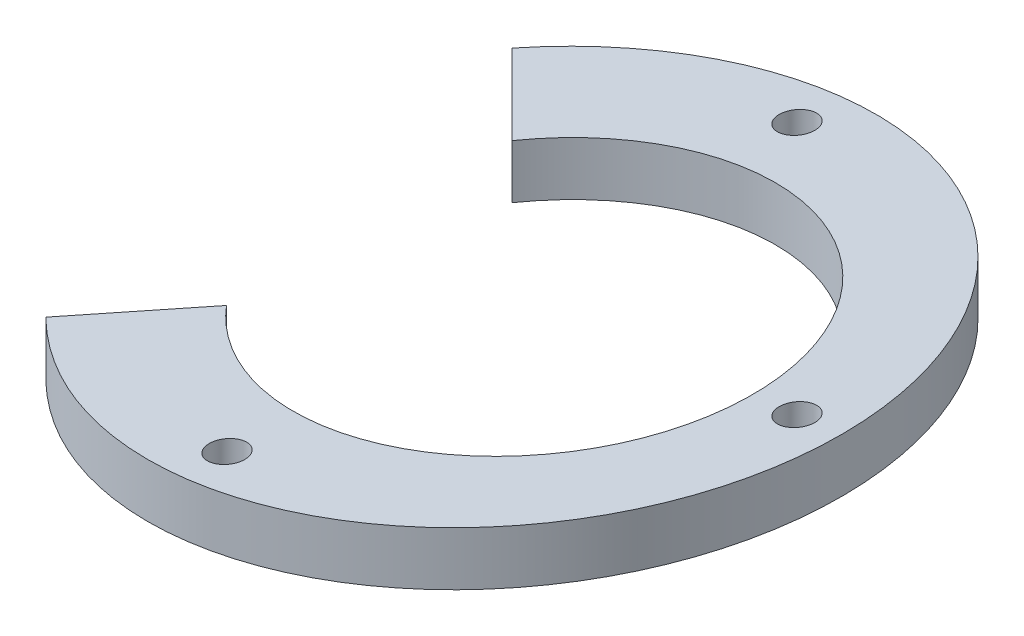
from build123d import *

# Parameters (mm, degrees)
SKETCH1_R           = 37
SKETCH1_R_2         = 2
SKETCH1_R_3         = 24.5
BOSS_EXTRUDE1_DEPTH = 50
CUT_EXTRUDE1_DEPTH  = 500
CUT_EXTRUDE2_REACH  = 56.255
SKETCH4_R           = 3.5
CUT_EXTRUDE3_DEPTH  = 10


with BuildPart() as part:
    # Sketch1 → Boss-Extrude1 (new body)
    with BuildSketch(Plane(origin=(0, 0, 0), x_dir=(1, 0, 0), z_dir=(0, 1, 0))):
        Circle(SKETCH1_R)
        with Locations((0, -32)):
            Circle(SKETCH1_R_2, mode=Mode.SUBTRACT)
        with Locations((32, 0)):
            Circle(SKETCH1_R_2, mode=Mode.SUBTRACT)
        with Locations((-32, 0)):
            Circle(SKETCH1_R_2, mode=Mode.SUBTRACT)
        with Locations((0, 32)):
            Circle(SKETCH1_R_2, mode=Mode.SUBTRACT)
        with Locations((2.5, 0)):
            Circle(SKETCH1_R_3, mode=Mode.SUBTRACT)
    extrude(amount=BOSS_EXTRUDE1_DEPTH)

    # Sketch2 → Cut-Extrude1 (cut, symmetric)
    with BuildSketch(Plane.XY):
        Polygon((37, 8.300429934), (-37, 0), (37, 0), align=None)
        Polygon((-37, 50), (-37, 6.037626979), (37, 14.338056913), (37, 50), align=None)
    extrude(amount=CUT_EXTRUDE1_DEPTH, both=True, mode=Mode.SUBTRACT)

    # Cut-Extrude2: up to this plane
    cut_extrude2_end = Plane(origin=(-0.68267481, 6.086183044, 0), z_dir=(-0.11146893220632582, 0.9937679191605964, 0))
    # Sketch4 → Cut-Extrude2 (cut, up to the surface)
    with BuildSketch(Plane(origin=(0, 0, 0), x_dir=(1, 0, 0), z_dir=(0, 1, 0)), mode=Mode.PRIVATE) as cut_extrude2_sk1:
        with Locations((-32, 0)):
            Circle(SKETCH4_R)
    cut_extrude2_tool1 = split(extrude(cut_extrude2_sk1.sketch, amount=CUT_EXTRUDE2_REACH, mode=Mode.PRIVATE), bisect_by=cut_extrude2_end, keep=Keep.BOTH, mode=Mode.PRIVATE)
    add(cut_extrude2_tool1.solids().sort_by_distance((-32, 0, 0))[0], mode=Mode.SUBTRACT)
    # Sketch4 → Cut-Extrude2 (cut, up to the surface)
    with BuildSketch(Plane(origin=(0, 0, 0), x_dir=(1, 0, 0), z_dir=(0, 1, 0)), mode=Mode.PRIVATE) as cut_extrude2_sk2:
        with Locations((0, 32)):
            Circle(SKETCH4_R)
    cut_extrude2_tool2 = split(extrude(cut_extrude2_sk2.sketch, amount=CUT_EXTRUDE2_REACH, mode=Mode.PRIVATE), bisect_by=cut_extrude2_end, keep=Keep.BOTH, mode=Mode.PRIVATE)
    add(cut_extrude2_tool2.solids().sort_by_distance((0, 0, -32))[0], mode=Mode.SUBTRACT)
    # Sketch4 → Cut-Extrude2 (cut, up to the surface)
    with BuildSketch(Plane(origin=(0, 0, 0), x_dir=(1, 0, 0), z_dir=(0, 1, 0)), mode=Mode.PRIVATE) as cut_extrude2_sk3:
        with Locations((32, 0)):
            Circle(SKETCH4_R)
    cut_extrude2_tool3 = split(extrude(cut_extrude2_sk3.sketch, amount=CUT_EXTRUDE2_REACH, mode=Mode.PRIVATE), bisect_by=cut_extrude2_end, keep=Keep.BOTH, mode=Mode.PRIVATE)
    add(cut_extrude2_tool3.solids().sort_by_distance((32, 0, 0))[0], mode=Mode.SUBTRACT)
    # Sketch4 → Cut-Extrude2 (cut, up to the surface)
    with BuildSketch(Plane(origin=(0, 0, 0), x_dir=(1, 0, 0), z_dir=(0, 1, 0)), mode=Mode.PRIVATE) as cut_extrude2_sk4:
        with Locations((0, -32)):
            Circle(SKETCH4_R)
    cut_extrude2_tool4 = split(extrude(cut_extrude2_sk4.sketch, amount=CUT_EXTRUDE2_REACH, mode=Mode.PRIVATE), bisect_by=cut_extrude2_end, keep=Keep.BOTH, mode=Mode.PRIVATE)
    add(cut_extrude2_tool4.solids().sort_by_distance((0, 0, 32))[0], mode=Mode.SUBTRACT)

    # Sketch6 → Cut-Extrude3 (cut)
    with BuildSketch(Plane(origin=(0, 0, 0), x_dir=(1, 0, 0), z_dir=(0, 1, 0))):
        with BuildLine():
            Line((-26.162950904, -26.162950904), (0, 0))
            Line((0, 0), (-26.162950904, 26.162950904))
            ThreePointArc((-26.162950904, 26.162950904), (-37, 0), (-26.162950904, -26.162950904))
        make_face()
    extrude(amount=CUT_EXTRUDE3_DEPTH, mode=Mode.SUBTRACT)


solid = part.part
